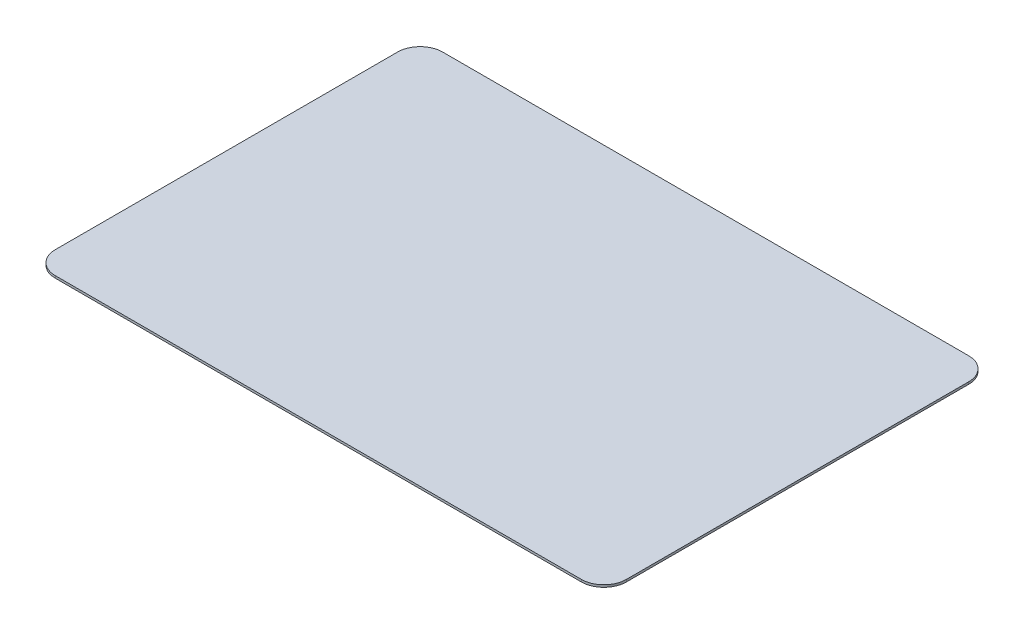
from build123d import *

# Parameters (mm, degrees)
SKETCH1_W           = 254
SKETCH1_H           = 172.27
BOSS_EXTRUDE1_DEPTH = 1
FILLET1_R           = 10


with BuildPart() as part:
    # Sketch1 → Boss-Extrude1 (new body)
    with BuildSketch(Plane(origin=(0, 0, 0), x_dir=(1, 0, 0), z_dir=(0, 1, 0))):
        Rectangle(SKETCH1_W, SKETCH1_H)
    extrude(amount=BOSS_EXTRUDE1_DEPTH)

    # Fillet1
    fillet1_edges = [part.edges().sort_by_distance(p)[0] for p in [
        (-127, 0.5, 86.135),
        (127, 0.5, 86.135),
        (127, 0.5, -86.135),
        (-127, 0.5, -86.135),
    ]]
    fillet(fillet1_edges, radius=FILLET1_R)


solid = part.part
